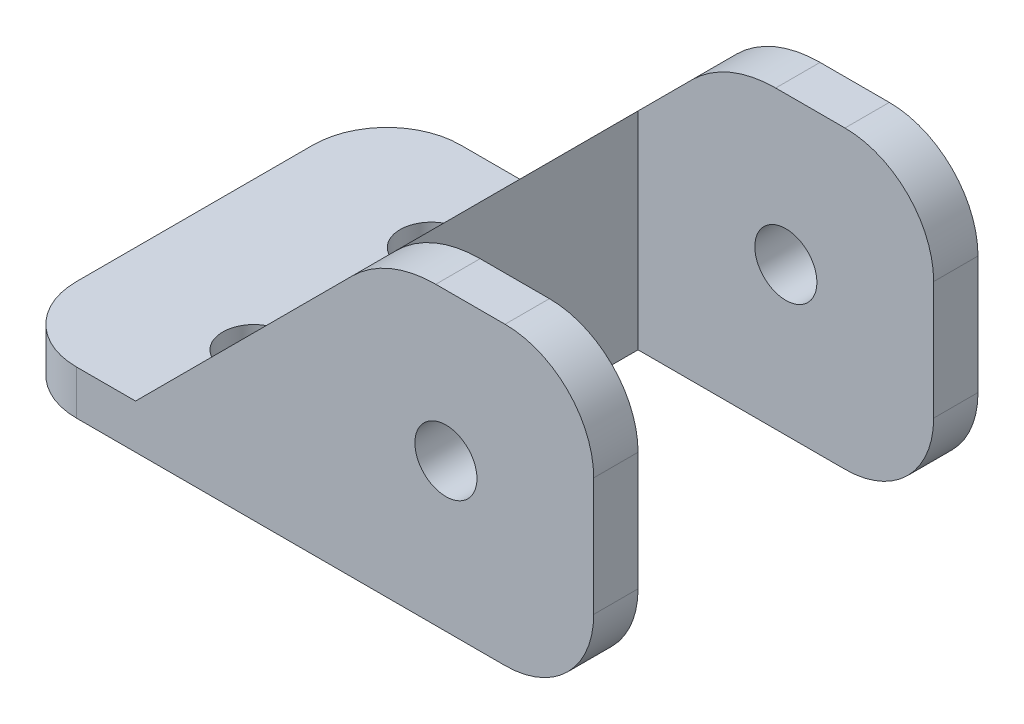
from build123d import *

# Parameters (mm, degrees)
SKETCH_1_R          = 2.1
EXTRUDE_1_DEPTH     = 3
SKETCH_3_W          = 20
SKETCH_3_H          = 3
EXTRUDE_2_DEPTH     = 20
FILLET_2_R          = 6
CHAMFER_2_SIZE      = 6
FILLET_3_R          = 8
EXTRUDE_5_DEPTH     = 26
SKETCH_12_R         = 2.1
CUT_EXTRUDE_4_DEPTH = 30
SKETCH_13_R         = 4
CUT_EXTRUDE_5_DEPTH = 30


with BuildPart() as part:
    # 草图1 → 凸台-拉伸1 (new body)
    with BuildSketch(Plane(origin=(0, 0, 0), x_dir=(1, 0, 0), z_dir=(0, 1, 0))):
        with BuildLine():
            Line((0, 0), (-15, 0))
            ThreePointArc((-15, 0), (-18.535533906, 1.464466094), (-20, 5))
            Line((-20, 5), (-20, 21))
            ThreePointArc((-20, 21), (-18.535533906, 24.535533906), (-15, 26))
            Line((-15, 26), (0, 26))
            Line((0, 26), (0, 0))
        make_face()
        with Locations((-10, 19)):
            Circle(SKETCH_1_R, mode=Mode.SUBTRACT)
        with Locations((-10, 7)):
            Circle(SKETCH_1_R, mode=Mode.SUBTRACT)
    extrude(amount=EXTRUDE_1_DEPTH)

    # 草图3 → 凸台-拉伸2 (add)
    with BuildSketch(Plane(origin=(0, 0, 0), x_dir=(1, 0, 0), z_dir=(0, 1, 0))):
        with Locations((10, 24.5)):
            Rectangle(SKETCH_3_W, SKETCH_3_H)
        with Locations((10, 1.5)):
            Rectangle(SKETCH_3_W, SKETCH_3_H)
    extrude(amount=EXTRUDE_2_DEPTH)

    # 圆角2
    fillet_2_edges = [part.edges().sort_by_distance(p)[0] for p in [
        (20, 20, -1.5),
        (20, 0, -1.5),
        (20, 20, -24.5),
        (20, 0, -24.5),
    ]]
    fillet(fillet_2_edges, radius=FILLET_2_R)

    # 倒角2
    chamfer_2_edges = [part.edges().sort_by_distance(p)[0] for p in [
        (0, 20, -1.5),
        (0, 20, -24.5),
    ]]
    chamfer(chamfer_2_edges, length=CHAMFER_2_SIZE)

    # 圆角3
    fillet_3_edges = [part.edges().sort_by_distance(p)[0] for p in [
        (6, 20, -1.5),
        (6, 20, -24.5),
    ]]
    fillet(fillet_3_edges, radius=FILLET_3_R)

    # 草图8 → 凸台-拉伸5 (add)
    with BuildSketch(Plane(origin=(0, 0, -26), x_dir=(-1, 0, 0), z_dir=(0, 0, -1))):
        Polygon((0, 14), (11, 3), (0, 3), align=None)
    extrude(amount=-EXTRUDE_5_DEPTH)

    # 草图12 → 切除-拉伸4 (cut)
    with BuildSketch(Plane.XY):
        with Locations((10, 10)):
            Circle(SKETCH_12_R)
    extrude(amount=-CUT_EXTRUDE_4_DEPTH, mode=Mode.SUBTRACT)

    # 草图13 → 切除-拉伸5 (cut)
    with BuildSketch(Plane(origin=(0, 3, 0), x_dir=(1, 0, 0), z_dir=(0, 1, 0))):
        with Locations((-10, 19)):
            Circle(SKETCH_13_R)
        with Locations((-10, 7)):
            Circle(SKETCH_13_R)
    extrude(amount=CUT_EXTRUDE_5_DEPTH, mode=Mode.SUBTRACT)


solid = part.part
